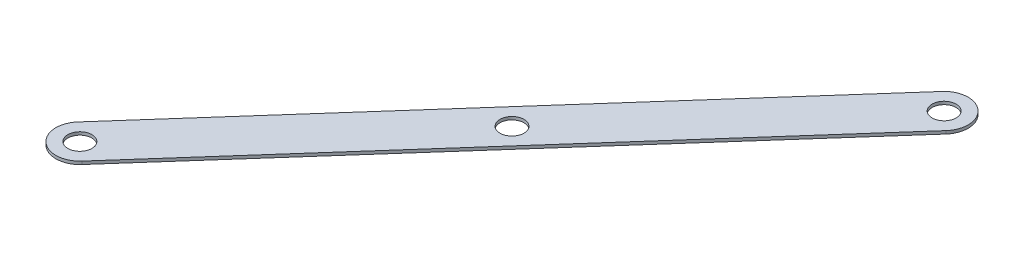
from build123d import *

# Parameters (mm, degrees)
SKETCH1_R           = 6.35
BOSS_EXTRUDE1_DEPTH = 1.5875


with BuildPart() as part:
    # Sketch1 → Boss-Extrude1 (new body)
    with BuildSketch(Plane(origin=(0, 0, 0), x_dir=(1, 0, 0), z_dir=(0, 1, 0))):
        with BuildLine():
            Line((-9.511548238, 8.415488704), (205.083413705, 250.959968766))
            ThreePointArc((205.083413705, 250.959968766), (223.010450646, 252.0560283), (224.10651018, 234.128991359))
            Line((224.10651018, 234.128991359), (9.511548238, -8.415488704))
            ThreePointArc((9.511548238, -8.415488704), (-8.415488704, -9.511548238), (-9.511548238, 8.415488704))
        make_face()
        with Locations((107.297480971, 121.272240031)):
            Circle(SKETCH1_R, mode=Mode.SUBTRACT)
        with Locations((214.594961942, 242.544480063)):
            Circle(SKETCH1_R, mode=Mode.SUBTRACT)
        Circle(SKETCH1_R, mode=Mode.SUBTRACT)
    extrude(amount=BOSS_EXTRUDE1_DEPTH)


solid = part.part
